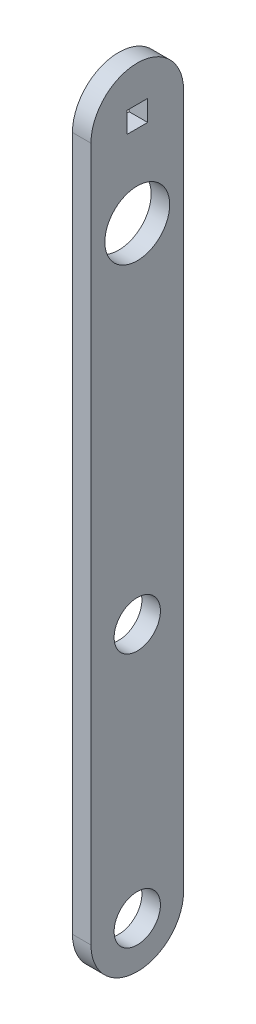
from build123d import *

# Parameters (mm, degrees)
BOSS_EXTRUDE1_DEPTH      = 4
BOSS_EXTRUDE1_DEPTH_BACK = 4
SKETCH2_R                = 10
SKETCH2_R_2              = 14
SKETCH2_W                = 9
SKETCH2_H                = 9


with BuildPart() as part:
    # Sketch2 → Boss-Extrude1 (new, two sides: drawn at the far end of the back side and taken through both)
    with BuildSketch(Plane(origin=(0, 0, 0), x_dir=(0, 0, -1), z_dir=(1, 0, 0)).offset(-BOSS_EXTRUDE1_DEPTH_BACK)):
        with BuildLine():
            ThreePointArc((20, 40), (0, 60), (-20, 40))
            Line((-20, 40), (-20, -260))
            ThreePointArc((-20, -260), (0, -280), (20, -260))
            Line((20, -260), (20, 40))
        make_face()
        with Locations((0, -260)):
            Circle(SKETCH2_R, mode=Mode.SUBTRACT)
        with Locations((0, -150)):
            Circle(SKETCH2_R, mode=Mode.SUBTRACT)
        Circle(SKETCH2_R_2, mode=Mode.SUBTRACT)
        with Locations((0, 40)):
            Rectangle(SKETCH2_W, SKETCH2_H, mode=Mode.SUBTRACT)
    extrude(amount=BOSS_EXTRUDE1_DEPTH + BOSS_EXTRUDE1_DEPTH_BACK)


solid = part.part
